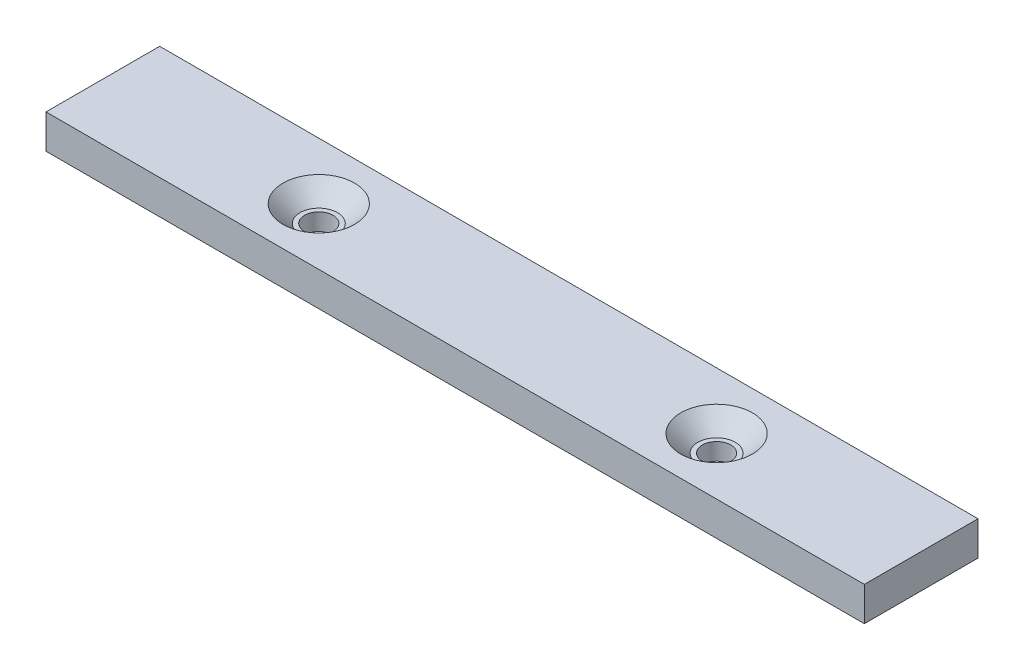
from build123d import *

# Parameters (mm, degrees)
SKETCH1_W           = 144
SKETCH1_H           = 20
BOSS_EXTRUDE1_DEPTH = 6


# Read off the part's stored shape, not the designer's step: AdvancedHole1
with BuildPart() as part:
    # Sketch1 → Boss-Extrude1 (new body)
    with BuildSketch(Plane(origin=(0, 0, 0), x_dir=(1, 0, 0), z_dir=(0, 1, 0))):
        Rectangle(SKETCH1_W, SKETCH1_H)
    extrude(amount=BOSS_EXTRUDE1_DEPTH)

    # AdvancedHole1 outline → AdvancedHole1 (revolve, cut)
    with BuildSketch(Plane(origin=(36, 0, 0), x_dir=(1, 0, 0), z_dir=(0, 0, 1))):
        Polygon((0, 0), (2.5, 0), (2.5, 3), (3.3, 3), (6.3, 6), (0, 6), align=None)
    revolve(axis=Axis((36, 0, 0), (0, 1, 0)), mode=Mode.SUBTRACT)

    # AdvancedHole1 2 outline → AdvancedHole1 2 (revolve, cut)
    with BuildSketch(Plane(origin=(-34, 0, 0), x_dir=(1, 0, 0), z_dir=(0, 0, 1))):
        Polygon((6.3, 6), (0, 6), (0, 0), (2.5, 0), (2.5, 3), (3.3, 3), align=None)
    revolve(axis=Axis((-34, 0, 0), (0, 1, 0)), mode=Mode.SUBTRACT)


solid = part.part
